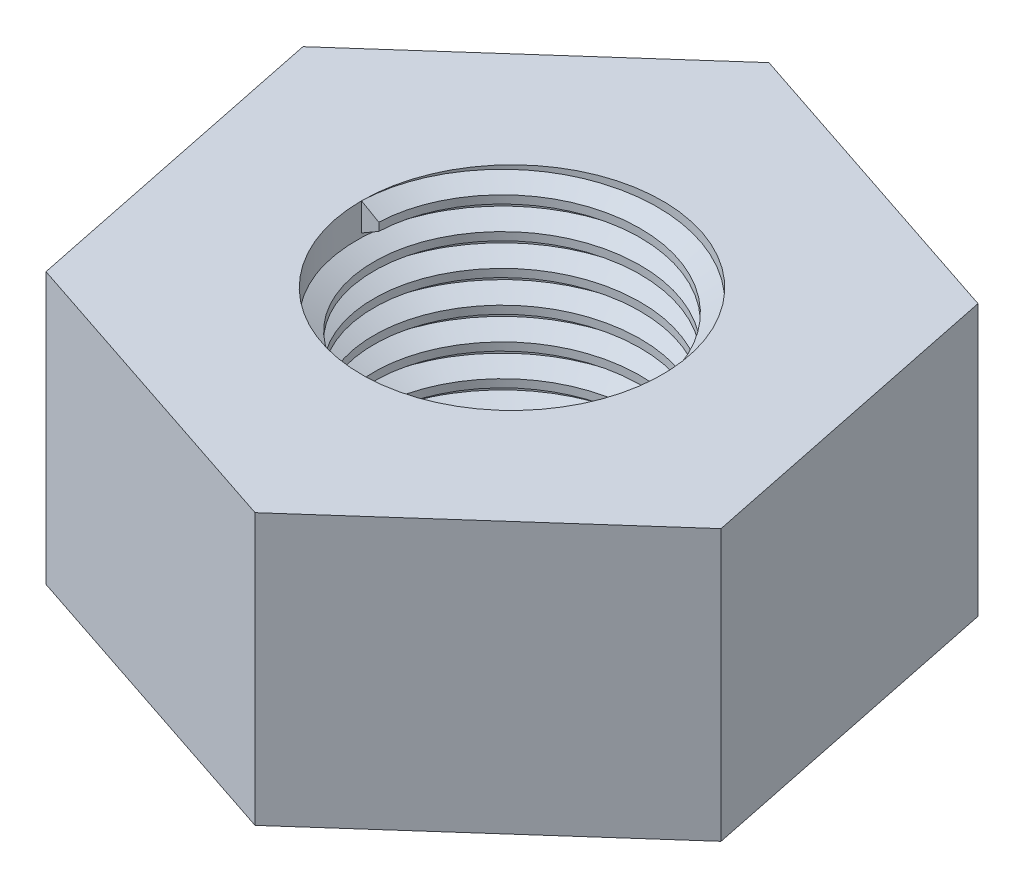
from build123d import *
from build123d.topology import SkipClean

# Parameters (mm, degrees)
SKETCH1_R          = 5
BASE_FLANGE1_DEPTH = 9
THREAD1_PITCH      = 1.058333333


# Sheet-metal steps are written as plain solids
with BuildPart() as part:
    # Sketch1 → Base-Flange1 (new body)
    with BuildSketch(Plane(origin=(0, 0, 0), x_dir=(1, 0, 0), z_dir=(0, 1, 0))):
        Polygon((8.202722694, 7.283452048), (-2.206293153, 10.745492257), (-10.409015848, 3.46204021), (-8.202722694, -7.283452048), (2.206293153, -10.745492257), (10.409015848, -3.46204021), align=None)
        with Locations(Location((0, 0, 0), (0, 0, 270))):
            Circle(SKETCH1_R, mode=Mode.SUBTRACT)
    extrude(amount=-BASE_FLANGE1_DEPTH)

    # Thread1: the profile of Thread Profile1 profile screwed along a right-hand helix of 8.503937 turns, 8 arcs to a turn; built about Z, then put on its axis
    with SkipClean():  # the faces are left unmerged after this step: merging them gives an invalid solid
        thread1_z = Axis((0, 0, 0), (0, 0, 1))
        thread1_corners = [(5.0003, 0, -0.000173205), (5.0003, 0, 0.926214869), (4.427160282, 0, 0.595312499), (4.427160282, 0, 0.330729165)]
        with BuildLine(mode=Mode.PRIVATE) as thread1_profile:
            Line(thread1_corners[0], thread1_corners[1])
            Line(thread1_corners[1], thread1_corners[2])
            Line(thread1_corners[2], thread1_corners[3])
            Line(thread1_corners[3], thread1_corners[0])
        thread1_cap = Face(thread1_profile.wire())
        thread1_turn_angles = [0, 22.5, 45, 67.5, 90, 112.5, 135, 157.5, 180, 202.5, 225, 247.5, 270, 292.5, 315, 337.5, 360]
        thread1_turn_weights = [1, 0.9238795325112867, 1, 0.9238795325112867, 1, 0.9238795325112867, 1, 0.9238795325112867, 1, 0.9238795325112867, 1, 0.9238795325112867, 1, 0.9238795325112867, 1, 0.9238795325112867, 1]
        thread1_turn_rails = [Edge.make_bspline([Vector(p[0], p[1], 0).rotate(thread1_z, thread1_turn_angles[k]) / thread1_turn_weights[k] + Vector(0, 0, p[2] + THREAD1_PITCH * thread1_turn_angles[k] / 360) for k in range(17)], [0, 0, 0, 1, 1, 2, 2, 3, 3, 4, 4, 5, 5, 6, 6, 7, 7, 8, 8, 8], 2, thread1_turn_weights) for p in thread1_corners]
        thread1_turn_sides = [Face.make_surface_from_curves(thread1_turn_rails[p[0]], thread1_turn_rails[p[1]]) for p in [(0, 1), (1, 2), (2, 3), (3, 0)]]
        thread1_last_angles = [2880, 2902.5, 2925, 2947.5, 2970, 2992.5, 3015, 3037.5, 3060, 3060.708661417, 3061.417322835]
        thread1_last_weights = [1, 0.9238795325112867, 1, 0.9238795325112867, 1, 0.9238795325112867, 1, 0.9238795325112867, 1, 0.9999235113880168, 1]
        thread1_last_rails = [Edge.make_bspline([Vector(p[0], p[1], 0).rotate(thread1_z, thread1_last_angles[k]) / thread1_last_weights[k] + Vector(0, 0, p[2] + THREAD1_PITCH * thread1_last_angles[k] / 360) for k in range(11)], [0, 0, 0, 1, 1, 2, 2, 3, 3, 4, 4, 5, 5, 5], 2, thread1_last_weights) for p in thread1_corners]
        thread1_last_sides = [Face.make_surface_from_curves(thread1_last_rails[p[0]], thread1_last_rails[p[1]]) for p in [(0, 1), (1, 2), (2, 3), (3, 0)]]
        thread1 = Plane(origin=(0, 0, 0), x_dir=(-1, 0, 0), z_dir=(0, -1, 0)) * Solid(Shell([*[p.moved(Location((0, 0, THREAD1_PITCH * i))) for i in range(8) for p in thread1_turn_sides], *thread1_last_sides, thread1_cap, thread1_cap.rotate(thread1_z, 3061.417322835).moved(Location((0, 0, THREAD1_PITCH * 3061.417322835 / 360)))]))
        add(thread1)


solid = part.part
